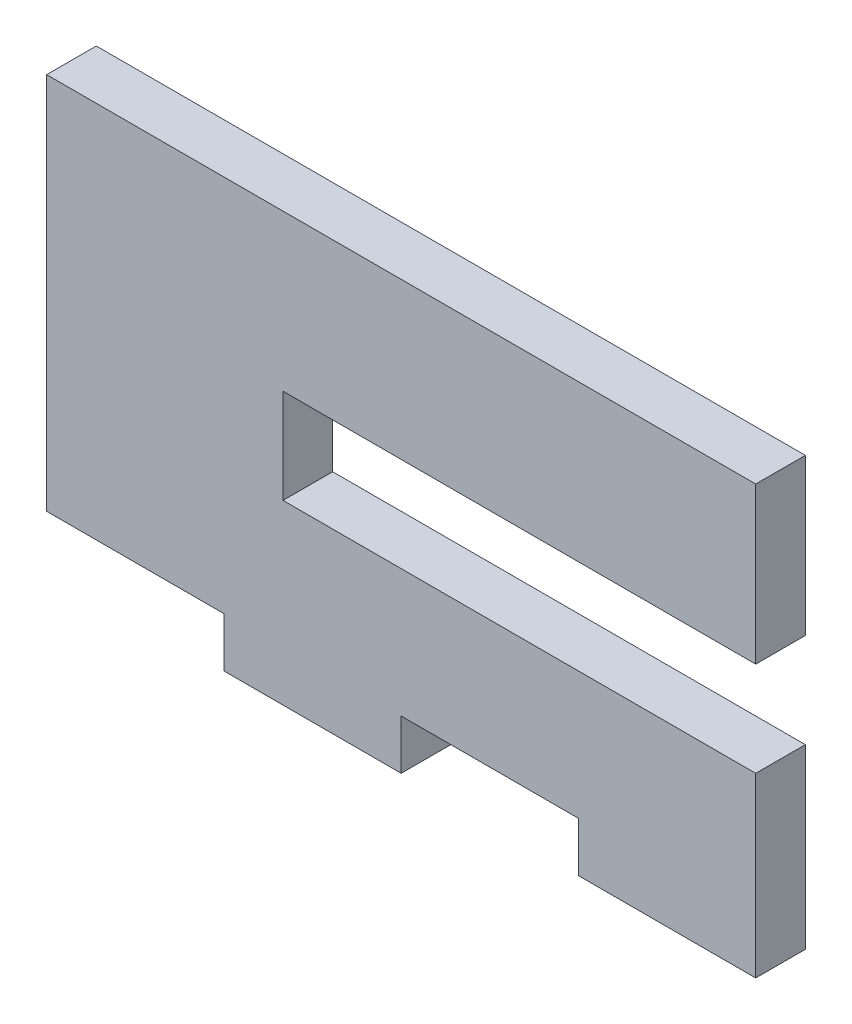
from build123d import *

# Parameters (mm, degrees)
SKETCH1_W           = 76.2
SKETCH1_H           = 45.974
BOSS_EXTRUDE1_DEPTH = 5.334
SKETCH2_W           = 19.05
SKETCH2_H           = 5.334
CUT_EXTRUDE1_DEPTH  = 478.783096008
SKETCH3_W           = 50.8
SKETCH3_H           = 10.16
CUT_EXTRUDE2_DEPTH  = 478.783096008


with BuildPart() as part:
    # Sketch1 → Boss-Extrude1 (new body)
    with BuildSketch(Plane.XY):
        with Locations((-344.780730467, 262.75865878)):
            Rectangle(SKETCH1_W, SKETCH1_H)
    extrude(amount=BOSS_EXTRUDE1_DEPTH)

    # Sketch2 → Cut-Extrude1 (cut, through all)
    with BuildSketch(Plane.XY.offset(5.334)):
        with Locations((-373.355730467, 242.43865878)):
            Rectangle(SKETCH2_W, SKETCH2_H)
        with Locations((-335.255730467, 242.43865878)):
            Rectangle(SKETCH2_W, SKETCH2_H)
    extrude(amount=-CUT_EXTRUDE1_DEPTH, mode=Mode.SUBTRACT)

    # Sketch3 → Cut-Extrude2 (cut, through all)
    with BuildSketch(Plane(origin=(0, 0, 0), x_dir=(-1, 0, 0), z_dir=(0, 0, -1))):
        with Locations((332.080730467, 263.90165878)):
            Rectangle(SKETCH3_W, SKETCH3_H)
    extrude(amount=-CUT_EXTRUDE2_DEPTH, mode=Mode.SUBTRACT)


solid = part.part
